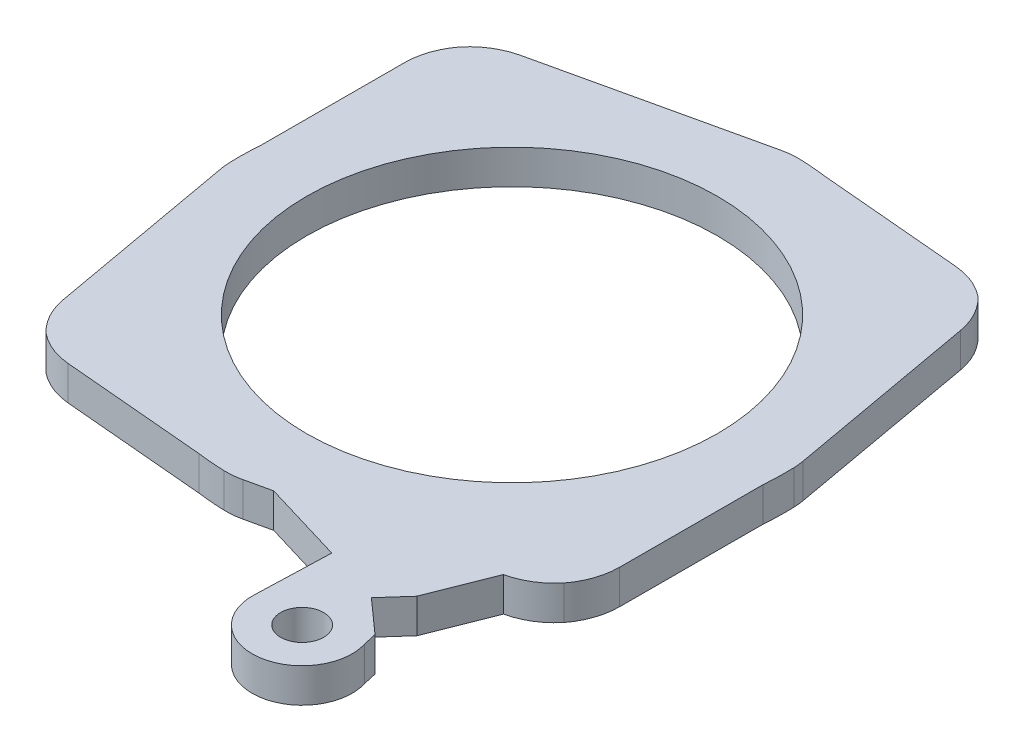
from build123d import *

# Parameters (mm, degrees)
SKETCH1_R           = 19.05
BOSS_EXTRUDE1_DEPTH = 1.5875
FILLET1_R           = 6.35
SKETCH4_R           = 1.9939
BOSS_EXTRUDE2_DEPTH = 3.175


with BuildPart() as part:
    # Sketch1 → Boss-Extrude1 (new, symmetric)
    with BuildSketch(Plane(origin=(0, 0, 0), x_dir=(1, 0, 0), z_dir=(0, 1, 0))):
        with BuildLine():
            Line((0, 25.8572), (-22.49266633, 20.776091776))
            ThreePointArc((-22.49266633, 20.776091776), (-23.925232015, 19.108880164), (-25.234496658, 17.343189053))
            Line((-25.234496658, 17.343189053), (-25.258396026, 1.987878879))
            ThreePointArc((-25.258396026, 1.987878879), (-25.334329361, 0.331644538), (-25.301777207, -1.326009955))
            Line((-25.301777207, -1.326009955), (-21.651397508, -21.651397508))
            ThreePointArc((-21.651397508, -21.651397508), (-20.188971055, -23.021109353), (-18.640092328, -24.292241274))
            Line((-18.640092328, -24.292241274), (-3.375041857, -25.63598807))
            ThreePointArc((-3.375041857, -25.63598807), (-1.691141793, -25.80183775), (0, -25.8572))
            Line((0, -25.8572), (22.49266633, -20.776091776))
            ThreePointArc((22.49266633, -20.776091776), (23.925232015, -19.108880164), (25.234496658, -17.343189053))
            Line((25.234496658, -17.343189053), (25.258396026, -1.987878879))
            ThreePointArc((25.258396026, -1.987878879), (25.334329361, -0.331644538), (25.301777207, 1.326009955))
            Line((25.301777207, 1.326009955), (21.651397508, 21.651397508))
            ThreePointArc((21.651397508, 21.651397508), (20.188971055, 23.021109353), (18.640092328, 24.292241274))
            Line((18.640092328, 24.292241274), (3.375041857, 25.63598807))
            ThreePointArc((3.375041857, 25.63598807), (1.691141793, 25.80183775), (0, 25.8572))
        make_face()
        with Locations(Location((0, 0, 0), (0, 0, 270))):
            Circle(SKETCH1_R, mode=Mode.SUBTRACT)
    extrude(amount=BOSS_EXTRUDE1_DEPTH, both=True)

    # Fillet1
    # the kernel refuses this fillet: 6.35 mm, written as the material it takes off along each edge
    with BuildSketch(Plane(origin=(25.301777207, -2.821548673, -1.326009955), x_dir=(-0.17676882960283344, 0, -0.9842523969393442), z_dir=(0, 1, 0)), Plane(origin=(-25.301777207, -2.821548673, 1.326009955), x_dir=(0.17676882960285092, 0, 0.9842523969393412), z_dir=(0, 1, 0))) as fillet1_piece_1:
        with BuildLine():
            CenterArc((0.427308397, 6.35), FILLET1_R, 261.702105294, 8.297894706)
            ThreePointArc((-0.489122596, 0.066477562), (-0.244723196, 0.032047583), (0, 0))
            Line((0, 0), (0.427308397, 0))
        make_face()
    extrude(amount=5.643097347, mode=Mode.SUBTRACT)
    with BuildSketch(Plane(origin=(0, -3.771668691, -25.8572), x_dir=(0.9998572847598118, 0, 0.016894085140560105), z_dir=(0, 1, 0))) as fillet1_piece_2:
        with BuildLine():
            CenterArc((0.766390036, -6.349093758), FILLET1_R, 89.031994173, 14.665503243)
            Line((-0.737262724, -0.179691163), (0, 0))
            ThreePointArc((0, 0), (0.436833738, 0.003690217), (0.873667477, 0))
        make_face()
    extrude(amount=7.543337383, mode=Mode.SUBTRACT)
    with BuildSketch(Plane(origin=(-22.49266633, -7.488620609, -20.776091776), x_dir=(-0.649702048384586, 0, 0.7601889556714653), z_dir=(0, 1, 0)), Plane(origin=(22.49266633, -7.488620609, 20.776091776), x_dir=(0.6497020483845872, 0, -0.7601889556714644), z_dir=(0, 1, 0))) as fillet1_piece_3:
        with BuildLine():
            CenterArc((2.115690027, 6.345281193), FILLET1_R, 233.248632952, 38.960357221)
            Line((-1.683792582, 1.257410134), (0, 0))
            ThreePointArc((0, 0), (1.180224122, -0.022754088), (2.360448244, 0))
        make_face()
    extrude(amount=14.977241219, mode=Mode.SUBTRACT)
    with BuildSketch(Plane(origin=(-25.234496658, -7.46444532, -17.343189053), x_dir=(-0.0015564217956219107, 0, 0.9999987887748636), z_dir=(0, 1, 0)), Plane(origin=(25.234496658, -7.46444532, 17.343189053), x_dir=(0.0015564217956202159, 0, -0.9999987887748636), z_dir=(0, 1, 0))) as fillet1_piece_4:
        with BuildLine():
            CenterArc((2.092875431, 6.35), FILLET1_R, 231.189304273, 38.810695727)
            ThreePointArc((-1.886982522, 1.401946779), (-0.956950246, 0.682857958), (0, 0))
            Line((0, 0), (2.092875431, 0))
        make_face()
    extrude(amount=14.928890641, mode=Mode.SUBTRACT)
    with BuildSketch(Plane(origin=(-21.651397508, -7.539410962, 21.651397508), x_dir=(0.7340619600556395, 0, 0.6790824977860002), z_dir=(0, 1, 0))) as fillet1_piece_5:
        with BuildLine():
            CenterArc((2.133899558, 6.345199584), FILLET1_R, 232.953597243, 39.274415035)
            Line((-1.691731763, 1.276960738), (0, 0))
            ThreePointArc((0, 0), (1.190382192, -0.023147607), (2.380764385, 0))
        make_face()
    extrude(amount=15.078821924, mode=Mode.SUBTRACT)
    with BuildSketch(Plane(origin=(-18.640092328, -7.110021665, 24.292241274), x_dir=(0.9961479372781339, 0, 0.08768857996637193), z_dir=(0, 1, 0))) as fillet1_piece_6:
        with BuildLine():
            CenterArc((1.966659426, 6.35), FILLET1_R, 233.396238517, 36.603761483)
            ThreePointArc((-1.8197032, 1.252357597), (-0.92114894, 0.609763515), (0, 0))
            Line((0, 0), (1.966659426, 0))
        make_face()
    extrude(amount=14.22004333, mode=Mode.SUBTRACT)
    with BuildSketch(Plane(origin=(0, -3.771668691, 25.8572), x_dir=(0.9754212543155903, 0, -0.22034830752560894), z_dir=(0, 1, 0))) as fillet1_piece_7:
        with BuildLine():
            CenterArc((0.758844673, 6.35), FILLET1_R, 255.334496757, 14.665503243)
            ThreePointArc((-0.848819905, 0.206880711), (-0.42528378, 0.099855091), (0, 0))
            Line((0, 0), (0.758844673, 0))
        make_face()
    extrude(amount=7.543337383, mode=Mode.SUBTRACT)
    with BuildSketch(Plane(origin=(18.640092328, 7.110021665, -24.292241274), x_dir=(-0.9961479372781336, 0, -0.08768857996637594), z_dir=(0, -1, 0))) as fillet1_piece_8:
        with BuildLine():
            CenterArc((1.966659426, -6.35), FILLET1_R, 90, 36.603761483)
            ThreePointArc((-1.8197032, -1.252357597), (-0.92114894, -0.609763515), (0, 0))
            Line((0, 0), (1.966659426, 0))
        make_face()
    extrude(amount=14.22004333, mode=Mode.SUBTRACT)
    with BuildSketch(Plane(origin=(21.651397508, 7.539410962, -21.651397508), x_dir=(-0.7340619600556043, 0, -0.679082497786038), z_dir=(0, -1, 0))) as fillet1_piece_9:
        with BuildLine():
            CenterArc((2.133899558, -6.345199584), FILLET1_R, 87.771987722, 39.274415035)
            Line((-1.691731763, -1.276960738), (0, 0))
            ThreePointArc((0, 0), (1.190382192, 0.023147607), (2.380764385, 0))
        make_face()
    extrude(amount=15.078821924, mode=Mode.SUBTRACT)

    # Sketch4 → Boss-Extrude2 (add)
    with BuildSketch(Plane(origin=(0, 1.5875, 0), x_dir=(1, 0, 0), z_dir=(0, 1, 0))):
        with BuildLine():
            Line((18.171090284, -26.981546007), (20.442833543, -21.23915036))
            Line((20.442833543, -21.23915036), (16.989846709, -22.019182373))
            Line((16.989846709, -22.019182373), (11.9001109, -23.168957064))
            Line((11.9001109, -23.168957064), (3.07364609, -25.162861312))
            Line((3.07364609, -25.162861312), (10.75965287, -27.467658849))
            Line((10.75965287, -27.467658849), (10.523541405, -34.452658849))
            ThreePointArc((10.523541405, -34.452658849), (15.772035547, -39.203698132), (19.584588194, -33.238506824))
            Line((19.584588194, -33.238506824), (19.305744856, -32.004144185))
            Line((19.305744856, -32.004144185), (16.179043161, -29.213406378))
            Line((16.179043161, -29.213406378), (18.171090284, -26.981546007))
        make_face()
        with Locations(Location((15.156395368, -34.609261559, 0), (0, 0, 270))):
            Circle(SKETCH4_R, mode=Mode.SUBTRACT)
    extrude(amount=-BOSS_EXTRUDE2_DEPTH)


solid = part.part
